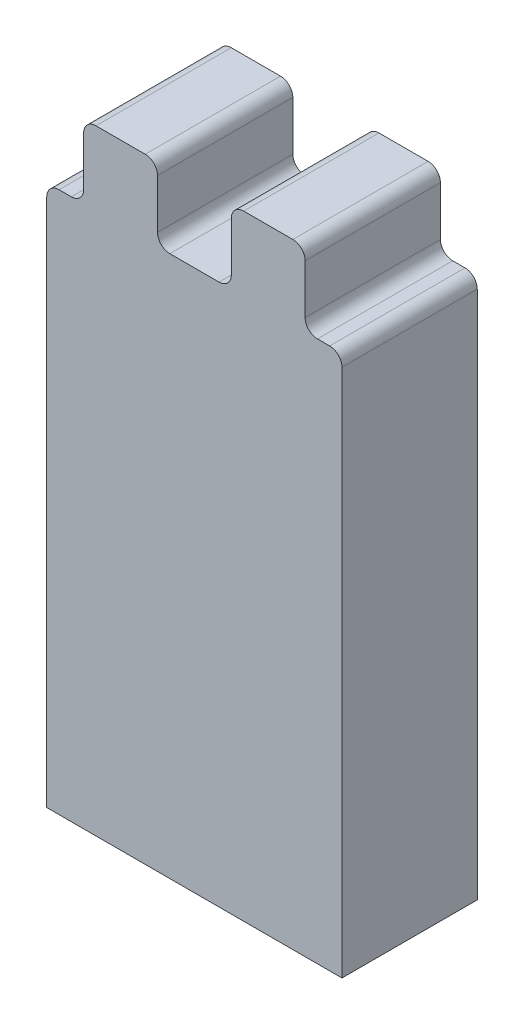
from build123d import *

# Parameters (mm, degrees)
SKETCH_1_W          = 12
SKETCH_1_H          = 25
EXTRUDE_1_DEPTH     = 5.5
SKETCH_2_W          = 1.5
SKETCH_2_H          = 3
SKETCH_2_W_2        = 1.49735379
SKETCH_2_W_3        = 3
CUT_EXTRUDE_1_DEPTH = 29.271009886
FILLET_2_R          = 0.5


with BuildPart() as part:
    # ｽｹｯﾁ1 → ﾎﾞｽ - 押し出し1 (new body)
    with BuildSketch(Plane.XY):
        with Locations((6, 12.5)):
            Rectangle(SKETCH_1_W, SKETCH_1_H)
    extrude(amount=EXTRUDE_1_DEPTH)

    # ｽｹｯﾁ2 → ｶｯﾄ - 押し出し1 (cut, through all)
    with BuildSketch(Plane.XY.offset(5.5)):
        with Locations((0.75, 23.5)):
            Rectangle(SKETCH_2_W, SKETCH_2_H)
        with Locations((11.251323105, 23.5)):
            Rectangle(SKETCH_2_W_2, SKETCH_2_H)
        with Locations((6.00264621, 23.5)):
            Rectangle(SKETCH_2_W_3, SKETCH_2_H)
    extrude(amount=-CUT_EXTRUDE_1_DEPTH, mode=Mode.SUBTRACT)

    # ﾌｨﾚｯﾄ2
    fillet_2_edges = [part.edges().sort_by_distance(p)[0] for p in [
        (10.50264621, 22, 2.75),
        (10.50264621, 25, 2.75),
        (7.50264621, 25, 2.75),
        (7.50264621, 22, 2.75),
        (4.50264621, 22, 2.75),
        (4.50264621, 25, 2.75),
        (1.5, 25, 2.75),
        (1.5, 22, 2.75),
        (12, 22, 2.75),
        (0, 22, 2.75),
    ]]
    fillet(fillet_2_edges, radius=FILLET_2_R)


solid = part.part
